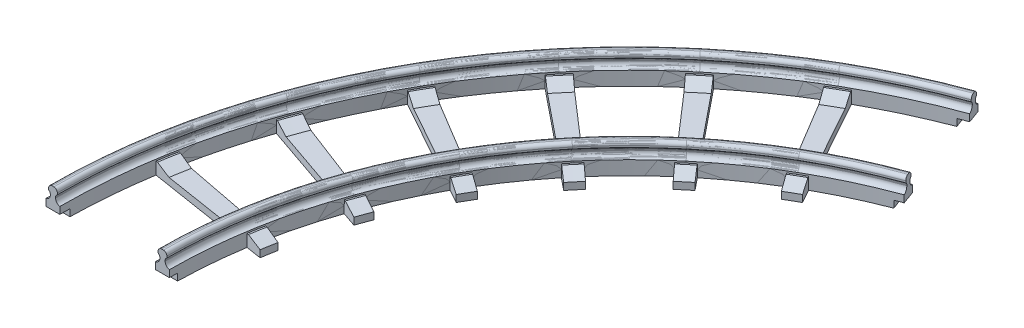
from build123d import *

# Parameters (mm, degrees)
REVOLVE_1_ANGLE          = 10
FILLET_1_R               = 1.5
FILLET_2_R               = 1.5
FILLET_3_R               = 1
FILLET_4_R               = 1
SKETCH_7_W               = 4
SKETCH_7_H               = 2
CUT_REVOLVE_1_ANGLE      = 1
SKETCH_10_R              = 0.4
CUT_EXTRUDE_1_DEPTH      = 2
REVOLVE_2_ANGLE          = 1
PATTERN_CIRCULAR_1_COUNT = 6
PATTERN_CIRCULAR_1_ANGLE = 50


with BuildPart() as part:
    # 草图4 → 旋转1 (revolve)
    with BuildSketch(Plane.XY):
        Polygon((0.75, -1.5), (1.25, -1.5), (1.25, 0), (0, 0), (-1.25, 0), (-1.25, -1.5), (-0.75, -1.5), (-0.75, -4), (-2, -4), (-2, -8), (0, -8), (2, -8), (2, -4), (0.75, -4), align=None)
        Polygon((31.5, 0), (32.75, 0), (32.75, -1.5), (32.25, -1.5), (32.25, -4), (33.5, -4), (33.5, -8), (31.5, -8), (29.5, -8), (29.5, -4), (30.75, -4), (30.75, -1.5), (30.25, -1.5), (30.25, 0), align=None)
    revolve(axis=Axis((165.75, 3.853460973, 0), (0, -1, 0)), revolution_arc=REVOLVE_1_ANGLE)

    # 圆角1
    # the kernel refuses this fillet: 1.5 mm, written as the material it adds along each edge
    with BuildSketch(Plane(origin=(165.75, -4, 0), x_dir=(-1, 0, 0), z_dir=(0, 0, 1))) as fillet_1_piece_1:
        with BuildLine():
            CenterArc((163.5, -1.479019946), FILLET_1_R, 0, 80.405931773)
            Line((165, -1.479019946), (165.03, -1.479019946))
            Line((165.03, -1.479019946), (165.03, 0))
            Line((165.03, 0), (165, 0.03))
            ThreePointArc((165, 0.03), (164.375, 0.03), (163.755, 0.029580399))
            Line((163.755, 0.029580399), (163.75, 0))
        make_face()
    revolve(axis=Axis((165.75, -4, 0), (0, -1, 0)), revolution_arc=10)
    with BuildSketch(Plane(origin=(165.75, -4, 0), x_dir=(-1, 0, 0), z_dir=(0, 0, 1))) as fillet_1_piece_2:
        with BuildLine():
            CenterArc((168, -1.479019946), FILLET_1_R, 99.594068227, 80.405931773)
            Line((166.5, -1.479019946), (166.47, -1.479019946))
            Line((166.47, -1.479019946), (166.47, 0))
            Line((166.47, 0), (166.5, 0.03))
            ThreePointArc((166.5, 0.03), (167.125, 0.03), (167.745, 0.029580399))
            Line((167.745, 0.029580399), (167.75, 0))
        make_face()
    revolve(axis=Axis((165.75, -4, 0), (0, -1, 0)), revolution_arc=10)

    # 圆角2
    # the kernel refuses this fillet: 1.5 mm, written as the material it adds along each edge
    with BuildSketch(Plane(origin=(165.75, -4, 0), x_dir=(-1, 0, 0), z_dir=(0, 0, 1))) as fillet_2_piece_1:
        with BuildLine():
            CenterArc((136.5, -1.479019946), FILLET_2_R, 99.594068227, 80.405931773)
            Line((136.25, 0), (136.245, 0.029580399))
            ThreePointArc((136.245, 0.029580399), (135.625, 0.03), (135, 0.03))
            Line((135, 0.03), (134.97, 0))
            Line((134.97, 0), (134.97, -1.479019946))
            Line((134.97, -1.479019946), (135, -1.479019946))
        make_face()
    revolve(axis=Axis((165.75, -4, 0), (0, -1, 0)), revolution_arc=10)
    with BuildSketch(Plane(origin=(165.75, -4, 0), x_dir=(-1, 0, 0), z_dir=(0, 0, 1))) as fillet_2_piece_2:
        with BuildLine():
            CenterArc((132, -1.479019946), FILLET_2_R, 0, 80.405931773)
            Line((133.5, -1.479019946), (133.53, -1.479019946))
            Line((133.53, -1.479019946), (133.53, 0))
            Line((133.53, 0), (133.5, 0.03))
            ThreePointArc((133.5, 0.03), (132.875, 0.03), (132.255, 0.029580399))
            Line((132.255, 0.029580399), (132.25, 0))
        make_face()
    revolve(axis=Axis((165.75, -4, 0), (0, -1, 0)), revolution_arc=10)

    # 圆角3
    # the kernel refuses this fillet: 1 mm, written as the material it adds along each edge
    with BuildSketch(Plane(origin=(165.75, -1.5, 0), x_dir=(-1, 0, 0), z_dir=(0, 0, 1))) as fillet_3_piece_1:
        with BuildLine():
            CenterArc((136, 0.866025404), FILLET_3_R, 180, 60)
            Line((135, 0.866025404), (135, 0))
            Line((135, 0), (135.5, 0))
        make_face()
    revolve(axis=Axis((165.75, -1.5, 0), (0, -1, 0)), revolution_arc=10)
    with BuildSketch(Plane(origin=(165.75, -1.5, 0), x_dir=(-1, 0, 0), z_dir=(0, 0, 1))) as fillet_3_piece_2:
        with BuildLine():
            CenterArc((132.5, 0.866025404), FILLET_3_R, 300, 60)
            Line((133, 0), (133.5, 0))
            Line((133.5, 0), (133.5, 0.866025404))
        make_face()
    revolve(axis=Axis((165.75, -1.5, 0), (0, -1, 0)), revolution_arc=10)
    # the kernel refuses this fillet: 1 mm, written as the material it takes off along each edge
    with BuildSketch(Plane(origin=(165.75, 0, 0), x_dir=(-0.9998233399867428, 0, 0.018795978765534377), z_dir=(0.018795978765534377, 0, 0.9998233399867428))) as fillet_3_2_piece_1:
        with BuildLine():
            CenterArc((133 + FILLET_3_R, FILLET_3_R), FILLET_3_R, 180, 90)
            Line((133, FILLET_3_R), (133, 0))
            Line((133, 0), (133 + FILLET_3_R, 0))
        make_face()
    revolve(axis=Axis((165.75, 0, 0), (0, -1, 0)), revolution_arc=12.153987353, mode=Mode.SUBTRACT)
    with BuildSketch(Plane(origin=(165.75, 0, 0), x_dir=(-0.9998297984864879, 0, 0.01844922921070363), z_dir=(0.01844922921070363, 0, 0.9998297984864879))) as fillet_3_2_piece_2:
        with BuildLine():
            CenterArc((135.5 - FILLET_3_R, FILLET_3_R), FILLET_3_R, 270, 90)
            Line((135.5 - FILLET_3_R, 0), (135.5, 0))
            Line((135.5, 0), (135.5, FILLET_3_R))
        make_face()
    revolve(axis=Axis((165.75, 0, 0), (0, -1, 0)), revolution_arc=12.114245889, mode=Mode.SUBTRACT)

    # 圆角4
    # the kernel refuses this fillet: 1 mm, written as the material it adds along each edge
    with BuildSketch(Plane(origin=(165.75, -1.5, 0), x_dir=(-1, 0, 0), z_dir=(0, 0, 1))) as fillet_4_piece_1:
        with BuildLine():
            CenterArc((167.5, 0.866025404), FILLET_4_R, 180, 60)
            Line((167, 0), (166.5, 0))
            Line((166.5, 0), (166.5, 0.866025404))
        make_face()
    revolve(axis=Axis((165.75, -1.5, 0), (0, -1, 0)), revolution_arc=10)
    with BuildSketch(Plane(origin=(165.75, -1.5, 0), x_dir=(-1, 0, 0), z_dir=(0, 0, 1))) as fillet_4_piece_2:
        with BuildLine():
            CenterArc((164, 0.866025404), FILLET_4_R, 300, 60)
            Line((164.5, 0), (165, 0))
            Line((165, 0), (165, 0.866025404))
        make_face()
    revolve(axis=Axis((165.75, -1.5, 0), (0, -1, 0)), revolution_arc=10)
    # the kernel refuses this fillet: 1 mm, written as the material it takes off along each edge
    with BuildSketch(Plane(origin=(165.75, 0, 0), x_dir=(-0.9998845180351503, 0, 0.015197058715919934), z_dir=(0.015197058715919934, 0, 0.9998845180351503))) as fillet_4_2_piece_1:
        with BuildLine():
            CenterArc((164.5 + FILLET_4_R, FILLET_4_R), FILLET_4_R, 180, 90)
            Line((164.5, FILLET_4_R), (164.5, 0))
            Line((164.5, 0), (164.5 + FILLET_4_R, 0))
        make_face()
    revolve(axis=Axis((165.75, 0, 0), (0, -1, 0)), revolution_arc=11.74152169, mode=Mode.SUBTRACT)
    with BuildSketch(Plane(origin=(165.75, 0, 0), x_dir=(-0.9998879496351009, 0, 0.014969574961036002), z_dir=(0.014969574961036002, 0, 0.9998879496351009))) as fillet_4_2_piece_2:
        with BuildLine():
            CenterArc((167 - FILLET_4_R, FILLET_4_R), FILLET_4_R, 270, 90)
            Line((167 - FILLET_4_R, 0), (167, 0))
            Line((167, 0), (167, FILLET_4_R))
        make_face()
    revolve(axis=Axis((165.75, 0, 0), (0, -1, 0)), revolution_arc=11.715451006, mode=Mode.SUBTRACT)

    # 草图7 → 切除-旋转1 (revolve, cut)
    with BuildSketch(Plane.XY):
        with Locations((0, -7)):
            Rectangle(SKETCH_7_W, SKETCH_7_H)
        with Locations((31.5, -7)):
            Rectangle(SKETCH_7_W, SKETCH_7_H)
    revolve(axis=Axis((165.75, 3.853460973, 0), (0, -1, 0)), revolution_arc=CUT_REVOLVE_1_ANGLE, mode=Mode.SUBTRACT)

    # 草图10 → 切除-拉伸1 (cut)
    with BuildSketch(Plane.XZ.offset(6)):
        with Locations(Location((0.006311252, -1.446423259, 0), (0, 0, 270))):
            Circle(SKETCH_10_R)
        with Locations(Location((31.505111829, -1.171537391, 0), (0, 0, 270))):
            Circle(SKETCH_10_R)
    extrude(amount=-CUT_EXTRUDE_1_DEPTH, mode=Mode.SUBTRACT)

    # 草图11 → 旋转2 (revolve)
    with BuildSketch(Plane(origin=(4.997974052, 0, -28.344919378), x_dir=(-0.9848077530122081, 0, -0.17364817766693072), z_dir=(0.17364817766693072, 0, -0.9848077530122081))):
        Polygon((-26.981885062, -4.5), (-26.481885062, -4.5), (-22.481885062, -6), (-3.981885062, -6), (0.018114938, -4.5), (0.518114938, -4.5), (4.518114938, -4.5), (5.018114938, -4.5), (9.018114938, -6), (9.018114938, -8), (4.518114938, -8), (0.518114938, -8), (-26.981885062, -8), (-30.981885062, -8), (-35.481885062, -8), (-35.481885062, -6), (-31.481885062, -4.5), (-30.981885062, -4.5), align=None)
    revolve(axis=Axis((165.75, 3.853460973, 0), (0, 1, 0)), revolution_arc=REVOLVE_2_ANGLE)

    # 镜向1: part across face


with BuildPart() as part_1:
    add(part.part)
    add(part.part.mirror(Plane(origin=(18.028837048, -5.996688627, -26.04722665), x_dir=(0.9848077529548817, 0, 0.17364817799204443), z_dir=(0.17364817799204443, 0, -0.9848077529548818))))


with BuildPart() as pattern_circular_1_1:
    # 阵列(圆周)1: pattern copy
    add(part_1.part.rotate(Axis((165.75, 0, 0), (0, -1, 0)), 1 * PATTERN_CIRCULAR_1_ANGLE / (PATTERN_CIRCULAR_1_COUNT - 1)))


with BuildPart() as pattern_circular_1_2:
    # 阵列(圆周)1: pattern copy
    add(part_1.part.rotate(Axis((165.75, 0, 0), (0, -1, 0)), 2 * PATTERN_CIRCULAR_1_ANGLE / (PATTERN_CIRCULAR_1_COUNT - 1)))


with BuildPart() as pattern_circular_1_3:
    # 阵列(圆周)1: pattern copy
    add(part_1.part.rotate(Axis((165.75, 0, 0), (0, -1, 0)), 3 * PATTERN_CIRCULAR_1_ANGLE / (PATTERN_CIRCULAR_1_COUNT - 1)))


with BuildPart() as pattern_circular_1_4:
    # 阵列(圆周)1: pattern copy
    add(part_1.part.rotate(Axis((165.75, 0, 0), (0, -1, 0)), 4 * PATTERN_CIRCULAR_1_ANGLE / (PATTERN_CIRCULAR_1_COUNT - 1)))


with BuildPart() as pattern_circular_1_5:
    # 阵列(圆周)1: pattern copy
    add(part_1.part.rotate(Axis((165.75, 0, 0), (0, -1, 0)), 5 * PATTERN_CIRCULAR_1_ANGLE / (PATTERN_CIRCULAR_1_COUNT - 1)))


solid = Compound([part_1.part, pattern_circular_1_1.part, pattern_circular_1_2.part, pattern_circular_1_3.part, pattern_circular_1_4.part, pattern_circular_1_5.part])
